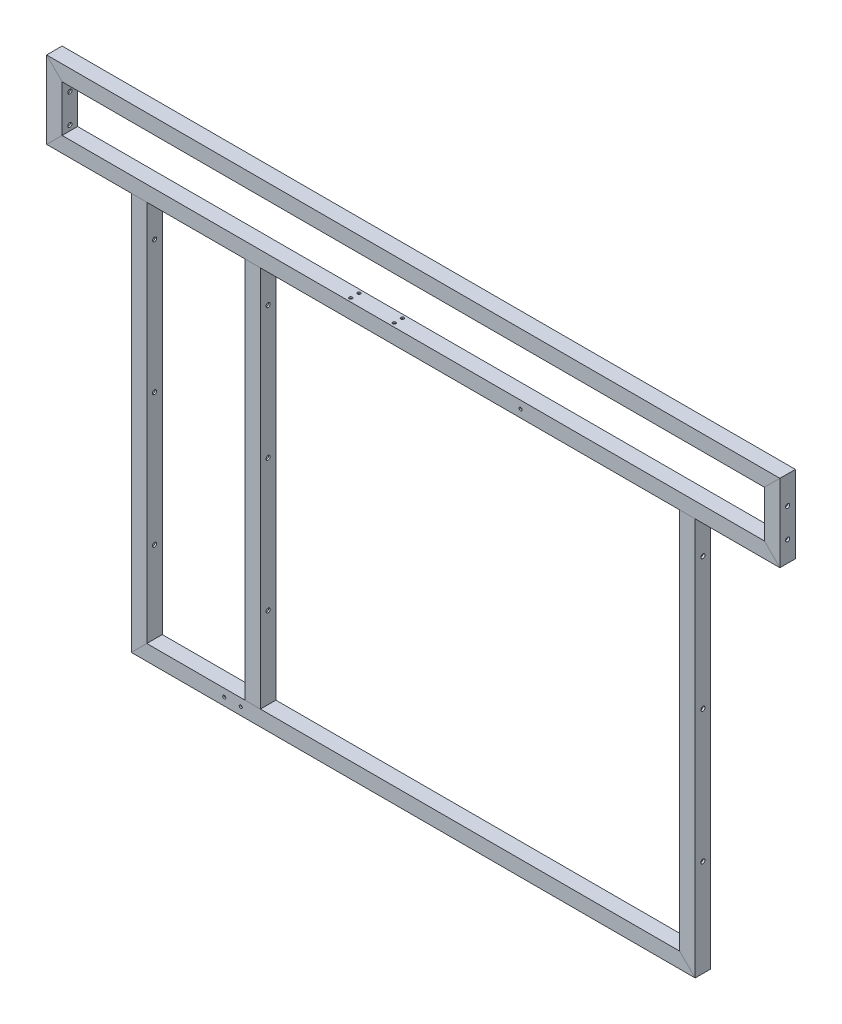
from build123d import *

# Parameters (mm, degrees)
MEMBER_START                     = -7.5
MEMBER_15_15_1_5_10_DEPTH        = 15
MEMBER_15_15_1_5_10_2_DEPTH      = 1.5
MEMBER_START_2                   = 6
MEMBER_15_15_1_5_10_3_DEPTH      = 1.5
MEMBER_15_15_1_5_10_4_DEPTH      = 15
MEMBER_15_15_1_5_10_5_DEPTH      = 1.5
MEMBER_15_15_1_5_10_6_DEPTH      = 1.5
MEMBER_15_15_1_5_10_7_DEPTH      = 15
MEMBER_15_15_1_5_10_8_DEPTH      = 1.5
MEMBER_15_15_1_5_10_9_DEPTH      = 1.5
MEMBER_15_15_1_5_10_10_DEPTH     = 15
MEMBER_15_15_1_5_10_11_DEPTH     = 1.5
MEMBER_15_15_1_5_10_12_DEPTH     = 1.5
MEMBER_15_15_1_5_10_13_DEPTH     = 15
MEMBER_15_15_1_5_10_14_DEPTH     = 1.5
MEMBER_15_15_1_5_10_15_DEPTH     = 1.5
MEMBER_15_15_1_5_10_16_DEPTH     = 15
MEMBER_15_15_1_5_10_17_DEPTH     = 1.5
MEMBER_15_15_1_5_10_18_DEPTH     = 1.5
MEMBER_15_15_1_5_10_19_DEPTH     = 15
MEMBER_15_15_1_5_10_20_DEPTH     = 1.5
MEMBER_15_15_1_5_10_21_DEPTH     = 1.5
MEMBER_START_3                   = 102.5
MEMBER_15_15_1_5_10_22_OUTLINE_W = 370
MEMBER_15_15_1_5_10_22_OUTLINE_H = 1.5
MEMBER_15_15_1_5_10_22_DEPTH     = 15
MEMBER_15_15_1_5_10_23_OUTLINE_W = 370
MEMBER_15_15_1_5_10_23_OUTLINE_H = 12
MEMBER_15_15_1_5_10_23_DEPTH     = 2
MEMBER_START_4                   = 116
MEMBER_15_15_1_5_10_24_OUTLINE_W = 370
MEMBER_15_15_1_5_10_24_OUTLINE_H = 12
MEMBER_15_15_1_5_10_24_DEPTH     = 1.5
SKETCH_2_R                       = 2
CUT_EXTRUDE_2_DEPTH              = 775.077838463
SKETCH_3_R                       = 2
CUT_EXTRUDE_3_DEPTH              = 842.969417497
SKETCH_4_R                       = 1.5
CUT_EXTRUDE_4_DEPTH              = 15
SKETCH_5_R                       = 1.5
CUT_EXTRUDE_5_DEPTH              = 769.115551203
SKETCH_6_R                       = 1.5
CUT_EXTRUDE_6_DEPTH              = 769.115551203


# Read off the part's stored shape, not the designer's step: 方形管 15 ×15× 1.5(10)
with BuildPart() as part:
    # Member 15 _15_ 1.5_10 outline → Member 15 _15_ 1.5_10 (new body)
    with BuildSketch(Plane.XY.offset(MEMBER_START)):
        Polygon((-74.5, 392.5), (-74.5, 437.5), (-76, 439), (-76, 391), align=None)
        Polygon((-87.5, 379.5), (-87.5, 450.5), (-89.5, 452.5), (-89.5, 377.5), align=None)
    extrude(amount=MEMBER_15_15_1_5_10_DEPTH)

    # Member 15 _15_ 1.5_10 2 outline → Member 15 _15_ 1.5_10 2 (add)
    with BuildSketch(Plane.XY.offset(MEMBER_START)):
        Polygon((-76, 391), (-76, 439), (-87.5, 450.5), (-87.5, 379.5), align=None)
    extrude(amount=MEMBER_15_15_1_5_10_2_DEPTH)

    # Member 15 _15_ 1.5_10 3 outline → Member 15 _15_ 1.5_10 3 (add)
    with BuildSketch(Plane.XY.offset(MEMBER_START_2)):
        Polygon((-76, 391), (-76, 439), (-87.5, 450.5), (-87.5, 379.5), align=None)
    extrude(amount=MEMBER_15_15_1_5_10_3_DEPTH)


with BuildPart() as body_2:
    # Member 15 _15_ 1.5_10 4 outline → Member 15 _15_ 1.5_10 4 (new body)
    with BuildSketch(Plane.XY.offset(MEMBER_START)):
        Polygon((605.5, 392.5), (-74.5, 392.5), (-76, 391), (607, 391), align=None)
        Polygon((618.5, 379.5), (-87.5, 379.5), (-89.5, 377.5), (620.5, 377.5), align=None)
    extrude(amount=MEMBER_15_15_1_5_10_4_DEPTH)

    # Member 15 _15_ 1.5_10 5 outline → Member 15 _15_ 1.5_10 5 (add)
    with BuildSketch(Plane.XY.offset(MEMBER_START)):
        Polygon((607, 391), (-76, 391), (-87.5, 379.5), (618.5, 379.5), align=None)
    extrude(amount=MEMBER_15_15_1_5_10_5_DEPTH)

    # Member 15 _15_ 1.5_10 6 outline → Member 15 _15_ 1.5_10 6 (add)
    with BuildSketch(Plane.XY.offset(MEMBER_START_2)):
        Polygon((607, 391), (-76, 391), (-87.5, 379.5), (618.5, 379.5), align=None)
    extrude(amount=MEMBER_15_15_1_5_10_6_DEPTH)

    # 草图4 → 切除-拉伸4 (cut)
    with BuildSketch(Plane.XZ.offset(-377.5)):
        with Locations(Location((201.5, 4, 0), (0, 0, 270))):
            Circle(SKETCH_4_R)
        with Locations(Location((243.5, 4, 0), (0, 0, 270))):
            Circle(SKETCH_4_R)
        with Locations(Location((243.5, -4, 0), (0, 0, 270))):
            Circle(SKETCH_4_R)
        with Locations(Location((201.5, -4, 0), (0, 0, 270))):
            Circle(SKETCH_4_R)
    extrude(amount=-CUT_EXTRUDE_4_DEPTH, mode=Mode.SUBTRACT)

    # 草图5 → 切除-拉伸5 (cut, through all)
    with BuildSketch(Plane.XY.offset(7.5)):
        with Locations((369.5, 385)):
            Circle(SKETCH_5_R)
    extrude(amount=-CUT_EXTRUDE_5_DEPTH, mode=Mode.SUBTRACT)


with BuildPart() as body_3:
    # Member 15 _15_ 1.5_10 7 outline → Member 15 _15_ 1.5_10 7 (new body)
    with BuildSketch(Plane.XY.offset(MEMBER_START)):
        Polygon((-74.5, 437.5), (605.5, 437.5), (607, 439), (-76, 439), align=None)
        Polygon((-87.5, 450.5), (618.5, 450.5), (620.5, 452.5), (-89.5, 452.5), align=None)
    extrude(amount=MEMBER_15_15_1_5_10_7_DEPTH)

    # Member 15 _15_ 1.5_10 8 outline → Member 15 _15_ 1.5_10 8 (add)
    with BuildSketch(Plane.XY.offset(MEMBER_START)):
        Polygon((-76, 439), (607, 439), (618.5, 450.5), (-87.5, 450.5), align=None)
    extrude(amount=MEMBER_15_15_1_5_10_8_DEPTH)

    # Member 15 _15_ 1.5_10 9 outline → Member 15 _15_ 1.5_10 9 (add)
    with BuildSketch(Plane.XY.offset(MEMBER_START_2)):
        Polygon((-76, 439), (607, 439), (618.5, 450.5), (-87.5, 450.5), align=None)
    extrude(amount=MEMBER_15_15_1_5_10_9_DEPTH)


with BuildPart() as body_4:
    # Member 15 _15_ 1.5_10 10 outline → Member 15 _15_ 1.5_10 10 (new body)
    with BuildSketch(Plane.XY.offset(MEMBER_START)):
        Polygon((605.5, 437.5), (605.5, 392.5), (607, 391), (607, 439), align=None)
        Polygon((618.5, 450.5), (618.5, 379.5), (620.5, 377.5), (620.5, 452.5), align=None)
    extrude(amount=MEMBER_15_15_1_5_10_10_DEPTH)

    # Member 15 _15_ 1.5_10 11 outline → Member 15 _15_ 1.5_10 11 (add)
    with BuildSketch(Plane.XY.offset(MEMBER_START)):
        Polygon((607, 439), (607, 391), (618.5, 379.5), (618.5, 450.5), align=None)
    extrude(amount=MEMBER_15_15_1_5_10_11_DEPTH)

    # Member 15 _15_ 1.5_10 12 outline → Member 15 _15_ 1.5_10 12 (add)
    with BuildSketch(Plane.XY.offset(MEMBER_START_2)):
        Polygon((607, 439), (607, 391), (618.5, 379.5), (618.5, 450.5), align=None)
    extrude(amount=MEMBER_15_15_1_5_10_12_DEPTH)


with BuildPart() as body_5:
    # Member 15 _15_ 1.5_10 13 outline → Member 15 _15_ 1.5_10 13 (new body)
    with BuildSketch(Plane.XY.offset(MEMBER_START)):
        Polygon((523.5, 377.5), (523.5, 7.5), (525, 6), (525, 377.5), align=None)
        Polygon((536.5, 377.5), (536.5, -5.5), (538.5, -7.5), (538.5, 377.5), align=None)
    extrude(amount=MEMBER_15_15_1_5_10_13_DEPTH)

    # Member 15 _15_ 1.5_10 14 outline → Member 15 _15_ 1.5_10 14 (add)
    with BuildSketch(Plane.XY.offset(MEMBER_START)):
        Polygon((525, 377.5), (525, 6), (536.5, -5.5), (536.5, 377.5), align=None)
    extrude(amount=MEMBER_15_15_1_5_10_14_DEPTH)

    # Member 15 _15_ 1.5_10 15 outline → Member 15 _15_ 1.5_10 15 (add)
    with BuildSketch(Plane.XY.offset(MEMBER_START_2)):
        Polygon((525, 377.5), (525, 6), (536.5, -5.5), (536.5, 377.5), align=None)
    extrude(amount=MEMBER_15_15_1_5_10_15_DEPTH)


with BuildPart() as body_6:
    # Member 15 _15_ 1.5_10 16 outline → Member 15 _15_ 1.5_10 16 (new body)
    with BuildSketch(Plane.XY.offset(MEMBER_START)):
        Polygon((523.5, 7.5), (7.5, 7.5), (6, 6), (525, 6), align=None)
        Polygon((536.5, -5.5), (-5.5, -5.5), (-7.5, -7.5), (538.5, -7.5), align=None)
    extrude(amount=MEMBER_15_15_1_5_10_16_DEPTH)

    # Member 15 _15_ 1.5_10 17 outline → Member 15 _15_ 1.5_10 17 (add)
    with BuildSketch(Plane.XY.offset(MEMBER_START)):
        Polygon((525, 6), (6, 6), (-5.5, -5.5), (536.5, -5.5), align=None)
    extrude(amount=MEMBER_15_15_1_5_10_17_DEPTH)

    # Member 15 _15_ 1.5_10 18 outline → Member 15 _15_ 1.5_10 18 (add)
    with BuildSketch(Plane.XY.offset(MEMBER_START_2)):
        Polygon((525, 6), (6, 6), (-5.5, -5.5), (536.5, -5.5), align=None)
    extrude(amount=MEMBER_15_15_1_5_10_18_DEPTH)

    # 草图6 → 切除-拉伸6 (cut, through all)
    with BuildSketch(Plane.XY.offset(7.5)):
        with Locations((82.5, 0)):
            Circle(SKETCH_6_R)
        with Locations((98.5, 0)):
            Circle(SKETCH_6_R)
    extrude(amount=-CUT_EXTRUDE_6_DEPTH, mode=Mode.SUBTRACT)


with BuildPart() as body_7:
    # Member 15 _15_ 1.5_10 19 outline → Member 15 _15_ 1.5_10 19 (new body)
    with BuildSketch(Plane.XY.offset(MEMBER_START)):
        Polygon((7.5, 7.5), (7.5, 377.5), (6, 377.5), (6, 6), align=None)
        Polygon((-5.5, -5.5), (-5.5, 377.5), (-7.5, 377.5), (-7.5, -7.5), align=None)
    extrude(amount=MEMBER_15_15_1_5_10_19_DEPTH)

    # Member 15 _15_ 1.5_10 20 outline → Member 15 _15_ 1.5_10 20 (add)
    with BuildSketch(Plane.XY.offset(MEMBER_START)):
        Polygon((6, 6), (6, 377.5), (-5.5, 377.5), (-5.5, -5.5), align=None)
    extrude(amount=MEMBER_15_15_1_5_10_20_DEPTH)

    # Member 15 _15_ 1.5_10 21 outline → Member 15 _15_ 1.5_10 21 (add)
    with BuildSketch(Plane.XY.offset(MEMBER_START_2)):
        Polygon((6, 6), (6, 377.5), (-5.5, 377.5), (-5.5, -5.5), align=None)
    extrude(amount=MEMBER_15_15_1_5_10_21_DEPTH)


with BuildPart() as body_8:
    # Member 15 _15_ 1.5_10 22 outline → Member 15 _15_ 1.5_10 22 (new body)
    with BuildSketch(Plane.YZ.offset(MEMBER_START_3)):
        with Locations((192.5, -6.75)):
            Rectangle(MEMBER_15_15_1_5_10_22_OUTLINE_W, MEMBER_15_15_1_5_10_22_OUTLINE_H)
        with Locations((192.5, 6.75)):
            Rectangle(MEMBER_15_15_1_5_10_22_OUTLINE_W, MEMBER_15_15_1_5_10_22_OUTLINE_H)
    extrude(amount=MEMBER_15_15_1_5_10_22_DEPTH)

    # Member 15 _15_ 1.5_10 23 outline → Member 15 _15_ 1.5_10 23 (add)
    with BuildSketch(Plane.YZ.offset(MEMBER_START_3)):
        with Locations((192.5, 0)):
            Rectangle(MEMBER_15_15_1_5_10_23_OUTLINE_W, MEMBER_15_15_1_5_10_23_OUTLINE_H)
    extrude(amount=MEMBER_15_15_1_5_10_23_DEPTH)

    # Member 15 _15_ 1.5_10 24 outline → Member 15 _15_ 1.5_10 24 (add)
    with BuildSketch(Plane.YZ.offset(MEMBER_START_4)):
        with Locations((192.5, 0)):
            Rectangle(MEMBER_15_15_1_5_10_24_OUTLINE_W, MEMBER_15_15_1_5_10_24_OUTLINE_H)
    extrude(amount=MEMBER_15_15_1_5_10_24_DEPTH)


with BuildPart() as cut_extrude_2_tool:
    # 草图2 → 切除-拉伸2 (new, through all)
    with BuildSketch(Plane.ZY.offset(7.5)):
        with Locations((0, 86.5)):
            Circle(SKETCH_2_R)
        with Locations((0, 214.5)):
            Circle(SKETCH_2_R)
        with Locations((0, 342.5)):
            Circle(SKETCH_2_R)
    extrude(amount=-CUT_EXTRUDE_2_DEPTH)


with BuildPart() as body_5_1:
    add(body_5.part)

    # 切除-拉伸2: cut by cut_extrude_2_tool
    add(cut_extrude_2_tool.part, mode=Mode.SUBTRACT)


with BuildPart() as body_7_1:
    add(body_7.part)

    # 切除-拉伸2: cut by cut_extrude_2_tool
    add(cut_extrude_2_tool.part, mode=Mode.SUBTRACT)


with BuildPart() as body_8_1:
    add(body_8.part)

    # 切除-拉伸2: cut by cut_extrude_2_tool
    add(cut_extrude_2_tool.part, mode=Mode.SUBTRACT)


with BuildPart() as cut_extrude_3_tool:
    # 草图3 → 切除-拉伸3 (new, through all)
    with BuildSketch(Plane.ZY.offset(89.5)):
        with Locations((0, 425.5)):
            Circle(SKETCH_3_R)
        with Locations((0, 397.5)):
            Circle(SKETCH_3_R)
    extrude(amount=-CUT_EXTRUDE_3_DEPTH)


with BuildPart() as part_1:
    add(part.part)

    # 切除-拉伸3: cut by cut_extrude_3_tool
    add(cut_extrude_3_tool.part, mode=Mode.SUBTRACT)


with BuildPart() as body_4_1:
    add(body_4.part)

    # 切除-拉伸3: cut by cut_extrude_3_tool
    add(cut_extrude_3_tool.part, mode=Mode.SUBTRACT)


solid = Compound([body_2.part, body_3.part, body_6.part, body_5_1.part, body_7_1.part, body_8_1.part, part_1.part, body_4_1.part])
